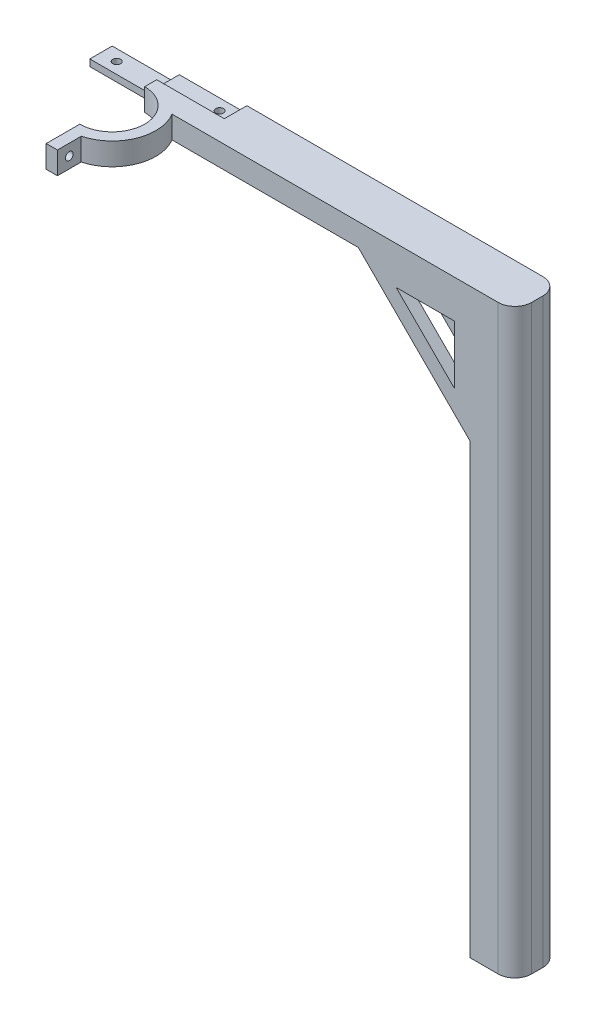
from build123d import *

# Parameters (mm, degrees)
SKETCH1_W                   = 20
SKETCH1_H                   = 20
BOSS_EXTRUDE1_DEPTH         = 260
SKETCH2_W                   = 20
SKETCH2_H                   = 10
BOSS_EXTRUDE2_DEPTH         = 150
BOSS_EXTRUDE3_DEPTH         = 10
CUT_EXTRUDE1_DEPTH          = 314.145732847
SKETCH4_R                   = 1.75
CUT_EXTRUDE2_DEPTH          = 311.459739741
BOSS_EXTRUDE4_DEPTH         = 5
FILLET3_R                   = 7.5
SKETCH7_R                   = 2.5
CUT_EXTRUDE3_DEPTH          = 8
BODY_MOVE_COPY1_DEPTH       = 260
BODY_MOVE_COPY1_START       = 200
BODY_MOVE_COPY1_2_OUTLINE_R = 14.5
BODY_MOVE_COPY1_2_DEPTH     = 60
BODY_MOVE_COPY1_START_2     = 8
BODY_MOVE_COPY1_3_DEPTH     = 208.899494937
BODY_MOVE_COPY1_4_OUTLINE_R = 2.5
BODY_MOVE_COPY1_4_DEPTH     = 8
BODY_MOVE_COPY1_START_3     = -20
BODY_MOVE_COPY1_5_DEPTH     = 59.5
BODY_MOVE_COPY1_START_4     = -15
BODY_MOVE_COPY1_6_DEPTH     = 10
BODY_MOVE_COPY1_START_5     = 170
BODY_MOVE_COPY1_7_OUTLINE_R = 1.75
BODY_MOVE_COPY1_7_DEPTH     = 5
SKETCH9_W                   = 10.1
SKETCH9_H                   = 3.1
CUT_EXTRUDE6_DEPTH          = 30.2
SKETCH10_W                  = 10
SKETCH10_H                  = 3
BOSS_EXTRUDE7_DEPTH         = 30
SKETCH12_R                  = 1.75
CUT_EXTRUDE7_DEPTH          = 428.969461527


with BuildPart() as part:
    # Sketch1 → Boss-Extrude1 (new body)
    with BuildSketch(Plane(origin=(0, 0, 0), x_dir=(1, 0, 0), z_dir=(0, 1, 0))):
        with Locations((10, 10)):
            Rectangle(SKETCH1_W, SKETCH1_H)
    extrude(amount=BOSS_EXTRUDE1_DEPTH)

    # Sketch2 → Boss-Extrude2 (add)
    with BuildSketch(Plane(origin=(20, 0, 0), x_dir=(0, 0, -1), z_dir=(1, 0, 0))):
        with Locations((10, 255)):
            Rectangle(SKETCH2_W, SKETCH2_H)
    extrude(amount=BOSS_EXTRUDE2_DEPTH)

    # Sketch3 → Boss-Extrude3 (add)
    with BuildSketch(Plane(origin=(0, 260, 0), x_dir=(1, 0, 0), z_dir=(0, 1, 0))):
        with BuildLine():
            Line((159.5, 0), (153.259330957, 0))
            ThreePointArc((153.259330957, 0), (151.938520085, -17.350710392), (165, -28.848076825))
            Line((165, -28.848076825), (165, -24.5))
            Line((165, -24.5), (170, -24.5))
            ThreePointArc((170, -24.5), (156.672397065, -15.711829829), (159.5, 0))
        make_face()
        with BuildLine():
            Line((165, -24.5), (165, -28.848076825))
            ThreePointArc((165, -28.848076825), (167.478839363, -29.336332358), (170, -29.5))
            Line((170, -29.5), (170, -24.5))
            Line((170, -24.5), (165, -24.5))
        make_face()
        with BuildLine():
            ThreePointArc((170, -29.5), (167.478839363, -29.336332358), (165, -28.848076825))
            Line((165, -28.848076825), (165, -39.5))
            Line((165, -39.5), (170, -39.5))
            Line((170, -39.5), (170, -29.5))
        make_face()
    extrude(amount=-BOSS_EXTRUDE3_DEPTH)

    # Sketch3<3> → Cut-Extrude1 (cut, through all)
    with BuildSketch(Plane(origin=(0, 260, 0), x_dir=(1, 0, 0), z_dir=(0, 1, 0))):
        with BuildLine():
            Line((170, 0), (170, 4.5))
            ThreePointArc((170, 4.5), (164.288170171, 3.327602935), (159.5, 0))
            Line((159.5, 0), (170, 0))
        make_face()
    extrude(amount=-CUT_EXTRUDE1_DEPTH, mode=Mode.SUBTRACT)

    # Sketch4 → Cut-Extrude2 (cut, through all)
    with BuildSketch(Plane.ZY.offset(-165)):
        with Locations((34.174038412, 255)):
            Circle(SKETCH4_R)
    extrude(amount=-CUT_EXTRUDE2_DEPTH, mode=Mode.SUBTRACT)

    # Sketch5 → Boss-Extrude4 (add)
    with BuildSketch(Plane.XY):
        Polygon((70, 250), (20, 200), (20, 250), align=None)
        Polygon((53.100505063, 243), (27, 216.899494937), (27, 243), align=None, mode=Mode.SUBTRACT)
    boss_extrude4 = extrude(amount=-BOSS_EXTRUDE4_DEPTH)

    # Mirror1: Boss-Extrude4 across plane
    add(boss_extrude4.mirror(Plane.XY.offset(-10)))

    # Fillet3
    fillet3_edges = [part.edges().sort_by_distance(p)[0] for p in [
        (0, 130, -20),
        (0, 130, 0),
    ]]
    fillet(fillet3_edges, radius=FILLET3_R)

    # Sketch7 → Cut-Extrude3 (cut)
    with BuildSketch(Plane.XZ):
        with Locations(Location((15, -5, 0), (0, 0, 270))):
            Circle(SKETCH7_R)
        with Locations(Location((5, -10, 0), (0, 0, 270))):
            Circle(SKETCH7_R)
        with Locations(Location((15, -15, 0), (0, 0, 270))):
            Circle(SKETCH7_R)
    extrude(amount=-CUT_EXTRUDE3_DEPTH, mode=Mode.SUBTRACT)

    # Body-Move/Copy1: read off the stored shape, not the designer's step
    # Body-Move/Copy1 outline → Body-Move/Copy1 (cut)
    with BuildSketch(Plane(origin=(0, 0, 0), x_dir=(1, 0, 0), z_dir=(0, 1, 0))):
        with BuildLine():
            Line((27, 15), (27, 20))
            Line((27, 20), (7.5, 20))
            ThreePointArc((7.5, 20), (2.196699141, 17.803300859), (0, 12.5))
            Line((0, 12.5), (0, 7.5))
            ThreePointArc((0, 7.5), (2.196699141, 2.196699141), (7.5, 0))
            Line((7.5, 0), (27, 0))
            Line((27, 0), (27, 5))
            Line((27, 5), (20, 5))
            Line((20, 5), (20, 15))
            Line((20, 15), (27, 15))
        make_face()
    extrude(amount=BODY_MOVE_COPY1_DEPTH, mode=Mode.SUBTRACT)

    # Body-Move_Copy1 2 outline → Body-Move_Copy1 2 (add)
    with BuildSketch(Plane(origin=(0, 0, 0), x_dir=(1, 0, 0), z_dir=(0, 1, 0)).offset(BODY_MOVE_COPY1_START)):
        with BuildLine():
            ThreePointArc((332.5, 0), (337.803300859, 2.196699141), (340, 7.5))
            Line((340, 7.5), (340, 12.5))
            ThreePointArc((340, 12.5), (337.803300859, 17.803300859), (332.5, 20))
            Line((332.5, 20), (27, 20))
            Line((27, 20), (27, 15))
            Line((27, 15), (20, 15))
            Line((20, 15), (20, 5))
            Line((20, 5), (27, 5))
            Line((27, 5), (27, 0))
            Line((27, 0), (153.259330957, 0))
            ThreePointArc((153.259330957, 0), (151.938520085, -17.350710392), (165, -28.848076825))
            Line((165, -28.848076825), (165, -39.5))
            Line((165, -39.5), (175, -39.5))
            Line((175, -39.5), (175, -28.848076825))
            ThreePointArc((175, -28.848076825), (188.061479915, -17.350710392), (186.740669043, 0))
            Line((186.740669043, 0), (332.5, 0))
        make_face()
        with Locations((170, -10)):
            Circle(BODY_MOVE_COPY1_2_OUTLINE_R, mode=Mode.SUBTRACT)
    extrude(amount=BODY_MOVE_COPY1_2_DEPTH)

    # Body-Move_Copy1 3 outline → Body-Move_Copy1 3 (add)
    with BuildSketch(Plane(origin=(0, 0, 0), x_dir=(1, 0, 0), z_dir=(0, 1, 0)).offset(BODY_MOVE_COPY1_START_2)):
        with BuildLine():
            Line((320, 0), (332.5, 0))
            ThreePointArc((332.5, 0), (337.803300859, 2.196699141), (340, 7.5))
            Line((340, 7.5), (340, 12.5))
            ThreePointArc((340, 12.5), (337.803300859, 17.803300859), (332.5, 20))
            Line((332.5, 20), (320, 20))
            Line((320, 20), (320, 0))
        make_face()
    extrude(amount=BODY_MOVE_COPY1_3_DEPTH)

    # Body-Move_Copy1 4 outline → Body-Move_Copy1 4 (add)
    with BuildSketch(Plane(origin=(0, 0, 0), x_dir=(1, 0, 0), z_dir=(0, 1, 0))):
        with BuildLine():
            Line((320, 20), (320, 0))
            Line((320, 0), (332.5, 0))
            ThreePointArc((332.5, 0), (337.803300859, 2.196699141), (340, 7.5))
            Line((340, 7.5), (340, 12.5))
            ThreePointArc((340, 12.5), (337.803300859, 17.803300859), (332.5, 20))
            Line((332.5, 20), (320, 20))
        make_face()
        with Locations((325, 5)):
            Circle(BODY_MOVE_COPY1_4_OUTLINE_R, mode=Mode.SUBTRACT)
        with Locations((335, 10)):
            Circle(BODY_MOVE_COPY1_4_OUTLINE_R, mode=Mode.SUBTRACT)
        with Locations((325, 15)):
            Circle(BODY_MOVE_COPY1_4_OUTLINE_R, mode=Mode.SUBTRACT)
    extrude(amount=BODY_MOVE_COPY1_4_DEPTH)

    # Body-Move_Copy1 5 outline → Body-Move_Copy1 5 (cut)
    with BuildSketch(Plane.XY.offset(BODY_MOVE_COPY1_START_3)):
        Polygon((320, 200), (270, 250), (170, 250), (170, 260), (20, 260), (20, 200), align=None)
        Polygon((313, 243), (286.899494937, 243), (313, 216.899494937), align=None)
    extrude(amount=BODY_MOVE_COPY1_5_DEPTH, mode=Mode.SUBTRACT)

    # Body-Move_Copy1 6 outline → Body-Move_Copy1 6 (cut)
    with BuildSketch(Plane.XY.offset(BODY_MOVE_COPY1_START_4)):
        Polygon((320, 200), (320, 250), (270, 250), align=None)
        Polygon((313, 216.899494937), (286.899494937, 243), (313, 243), align=None, mode=Mode.SUBTRACT)
    extrude(amount=BODY_MOVE_COPY1_6_DEPTH, mode=Mode.SUBTRACT)

    # Body-Move_Copy1 7 outline → Body-Move_Copy1 7 (cut)
    with BuildSketch(Plane.YZ.offset(BODY_MOVE_COPY1_START_5)):
        with Locations((255, 34.174038412)):
            Circle(BODY_MOVE_COPY1_7_OUTLINE_R)
    extrude(amount=BODY_MOVE_COPY1_7_DEPTH, mode=Mode.SUBTRACT)

    # Sketch9 → Cut-Extrude6 (cut)
    with BuildSketch(Plane(origin=(170, 0, 0), x_dir=(0, 0, -1), z_dir=(1, 0, 0))):
        with Locations((14.95, 258.45)):
            Rectangle(SKETCH9_W, SKETCH9_H)
    extrude(amount=CUT_EXTRUDE6_DEPTH, mode=Mode.SUBTRACT)

    # Sketch10 → Boss-Extrude7 (add)
    with BuildSketch(Plane(origin=(170, 0, 0), x_dir=(0, 0, -1), z_dir=(1, 0, 0))):
        with Locations((15, 251.5)):
            Rectangle(SKETCH10_W, SKETCH10_H)
    extrude(amount=-BOSS_EXTRUDE7_DEPTH)

    # Sketch12 → Cut-Extrude7 (cut, through all)
    with BuildSketch(Plane(origin=(0, 256.9, 0), x_dir=(1, 0, 0), z_dir=(0, 1, 0))):
        with Locations(Location((193, 15, 0), (0, 0, 270))):
            Circle(SKETCH12_R)
    cut_extrude7 = extrude(amount=-CUT_EXTRUDE7_DEPTH, mode=Mode.SUBTRACT)

    # Mirror2: Cut-Extrude7 across plane
    add(cut_extrude7.mirror(Plane.ZY.offset(-170)), mode=Mode.SUBTRACT)


solid = part.part
